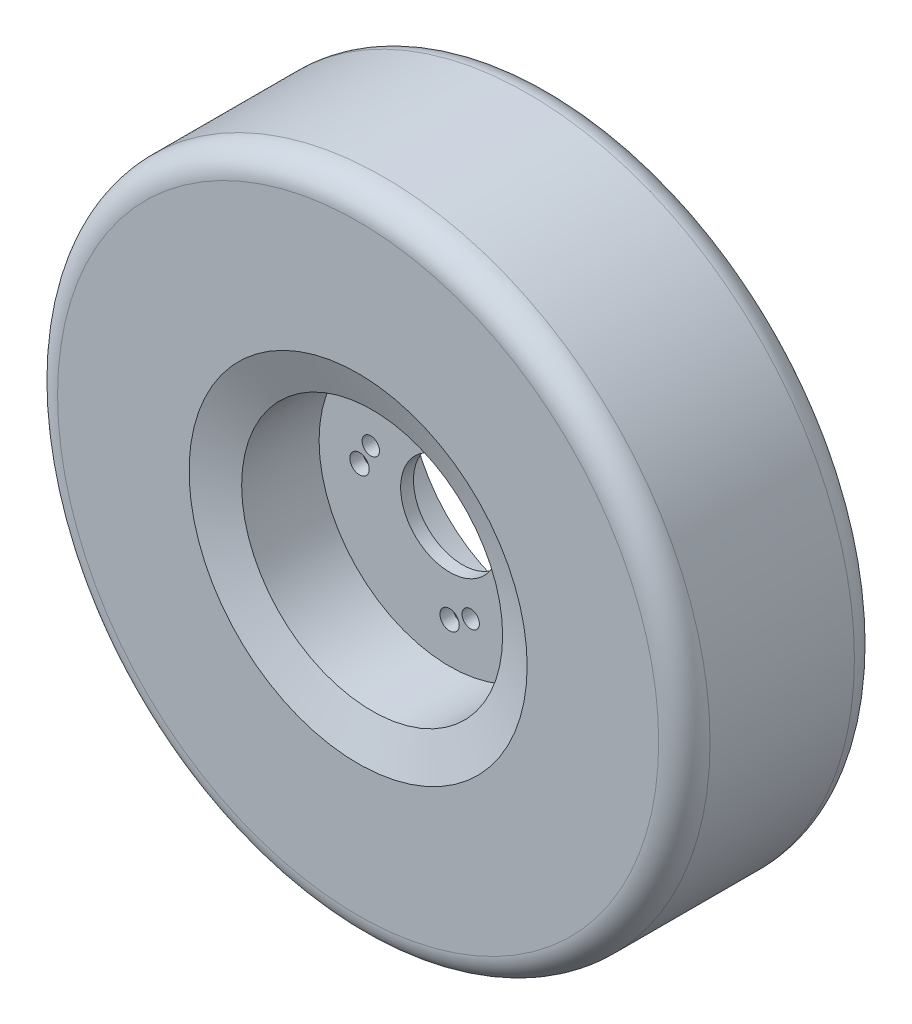
from build123d import *
from OCP.BRepFilletAPI import BRepFilletAPI_MakeChamfer

# Parameters (mm, degrees)
SKETCH1_R                            = 127
SKETCH1_R_2                          = 50.8
BOSS_EXTRUDE1_DEPTH                  = 38.1
CHAMFER1_SIZE                        = 15
CHAMFER1_SIZE2                       = 5.459553514
FILLET1_R                            = 10
SKETCH2_R                            = 50.8
SKETCH2_R_2                          = 19.05
BOSS_EXTRUDE2_DEPTH                  = 2.5
F_19_64_0_29688_DIAMETER_HOLE1_D     = 7.540752
F_19_64_0_29688_DIAMETER_HOLE1_DEPTH = 18.75
F_19_64_0_29688_DIAMETER_HOLE1_TIP   = 2.265470457
F_1_4_CLEARANCE_HOLE1_D              = 6.7564
F_1_4_CLEARANCE_HOLE1_DEPTH          = 18.75
F_1_4_CLEARANCE_HOLE1_TIP            = 2.029827343


with BuildPart() as part:
    # Sketch1 → Boss-Extrude1 (new, symmetric)
    with BuildSketch(Plane.XY):
        Circle(SKETCH1_R)
        Circle(SKETCH1_R_2, mode=Mode.SUBTRACT)
    extrude(amount=BOSS_EXTRUDE1_DEPTH, both=True)

    # Chamfer1: one chamfer whose edges measure the first distance from different faces: ONE call of the kernel's chamfer builder (chamfer() names one face for all edges)
    chamfer1_edges_1 = [part.edges().sort_by_distance(p)[0] for p in [
        (-50.8, 0, 38.1),
    ]]
    chamfer1_side_1 = [part.faces().sort_by_distance(p)[0] for p in [
        (-123.407897552, 0, 38.1),
    ]]
    chamfer1_edges_2 = [part.edges().sort_by_distance(p)[0] for p in [
        (-50.8, 0, -38.1),
    ]]
    chamfer1_side_2 = [part.faces().sort_by_distance(p)[0] for p in [
        (-123.407897552, 0, -38.1),
    ]]
    chamfer1 = BRepFilletAPI_MakeChamfer(part.part.solid().wrapped)
    for e in chamfer1_edges_1:
        chamfer1.Add(CHAMFER1_SIZE, CHAMFER1_SIZE2, e.wrapped, chamfer1_side_1[0].wrapped)  # the first distance lies on this face
    for e in chamfer1_edges_2:
        chamfer1.Add(CHAMFER1_SIZE, CHAMFER1_SIZE2, e.wrapped, chamfer1_side_2[0].wrapped)  # the first distance lies on this face
    add(Compound.cast(chamfer1.Shape()), mode=Mode.REPLACE)

    # Fillet1
    fillet1_edges = [part.edges().sort_by_distance(p)[0] for p in [
        (-127, 0, -38.1),
        (-127, 0, 38.1),
    ]]
    fillet(fillet1_edges, radius=FILLET1_R)

    # Sketch2 → Boss-Extrude2 (add, symmetric)
    with BuildSketch(Plane.XY):
        Circle(SKETCH2_R)
        Circle(SKETCH2_R_2, mode=Mode.SUBTRACT)
    extrude(amount=BOSS_EXTRUDE2_DEPTH, both=True)

    # 19/64 (0.29688) Diameter Hole1
    with Locations(Plane.XY.offset(2.5)):
        with Locations((0, 35.052), (35.052, 0), (0, -35.052), (-35.052, 0)):
            Hole(F_19_64_0_29688_DIAMETER_HOLE1_D / 2, depth=F_19_64_0_29688_DIAMETER_HOLE1_DEPTH)
            with Locations((0, 0, -(F_19_64_0_29688_DIAMETER_HOLE1_DEPTH + F_19_64_0_29688_DIAMETER_HOLE1_TIP / 2))):  # 118° drill point
                Cone(0, F_19_64_0_29688_DIAMETER_HOLE1_D / 2, F_19_64_0_29688_DIAMETER_HOLE1_TIP, mode=Mode.SUBTRACT)

    # 1/4 Clearance Hole1
    with Locations(Plane.XY.offset(2.5)):
        with Locations((-30.668144985, 8.217504682), (22.450640303, 22.450640303), (8.217504682, -30.668144985)):
            Hole(F_1_4_CLEARANCE_HOLE1_D / 2, depth=F_1_4_CLEARANCE_HOLE1_DEPTH)
            with Locations((0, 0, -(F_1_4_CLEARANCE_HOLE1_DEPTH + F_1_4_CLEARANCE_HOLE1_TIP / 2))):  # 118° drill point
                Cone(0, F_1_4_CLEARANCE_HOLE1_D / 2, F_1_4_CLEARANCE_HOLE1_TIP, mode=Mode.SUBTRACT)


solid = part.part
